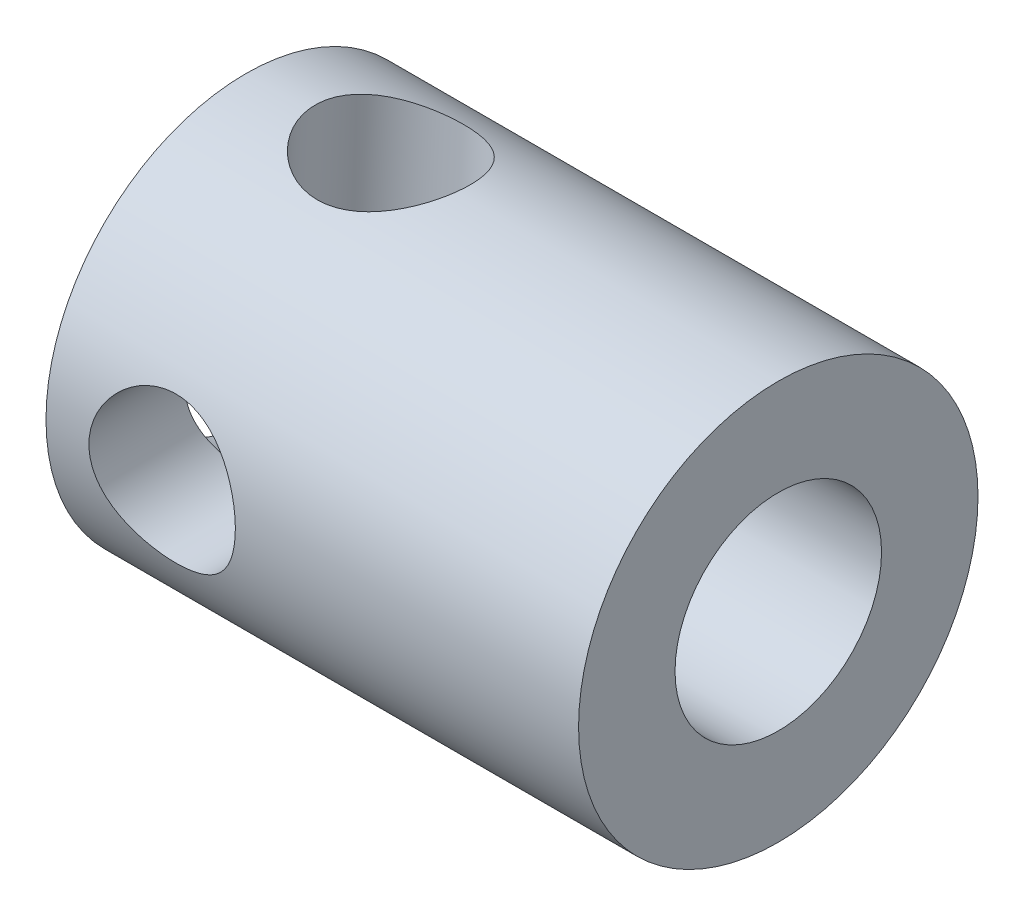
from build123d import *

# Parameters (mm, degrees)
CROQUIS1_R                             = 7.5
CROQUIS1_R_2                           = 3.877864762
SALIENTE_EXTRUIR1_DEPTH                = 20
TALADRO_DE_MARGEN_PARA_M51_D           = 5.5
TALADRO_DE_MARGEN_PARA_M51_ON_FACE_2_D = 5.5


with BuildPart() as part:
    # Croquis1 → Saliente-Extruir1 (new body)
    with BuildSketch(Plane(origin=(0, 0, 0), x_dir=(0, 0, -1), z_dir=(1, 0, 0))):
        Circle(CROQUIS1_R)
        Circle(CROQUIS1_R_2, mode=Mode.SUBTRACT)
    extrude(amount=SALIENTE_EXTRUIR1_DEPTH)

    # Taladro de margen para M51 (through all)
    with Locations(Plane(origin=(5.064139817, 7.489362629, -0.399308662), x_dir=(0, 0.05324115494, 0.9985816839), z_dir=(0, 0.9985816839, -0.05324115494))):
        with Locations((0, 0)):
            Hole(TALADRO_DE_MARGEN_PARA_M51_D / 2)

    # Taladro de margen para M51 on face 2 (through all)
    with Locations(Plane(origin=(4.35983128, 0.002429399, 7.499999607), x_dir=(0, 0.999999947512, -0.000323999983), z_dir=(0, 0.000323999983, 0.999999947512))):
        with Locations((0, 0)):
            Hole(TALADRO_DE_MARGEN_PARA_M51_ON_FACE_2_D / 2)


solid = part.part
